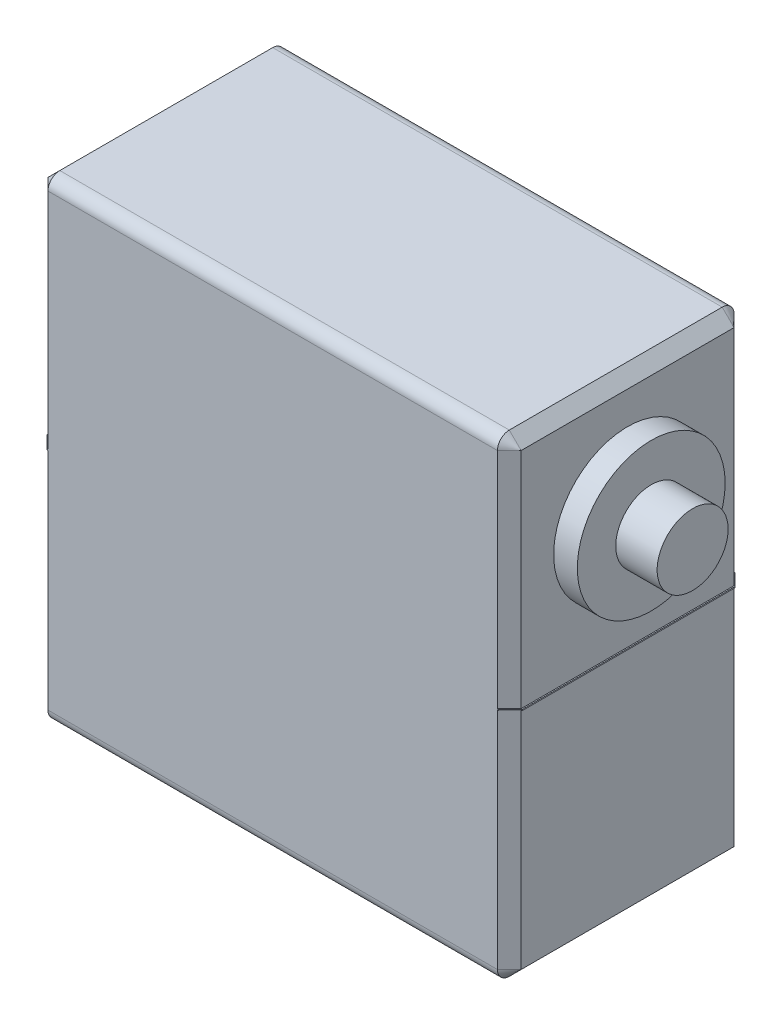
from build123d import *

# Parameters (mm, degrees)
EXTRUDE_439_DEPTH      = 20
EXTRUDE_654_DEPTH      = 2
EXTRUDE_654_DEPTH_BACK = 42
SKETCH2_R              = 6.25
EXTRUDE_763_DEPTH      = 3.5
EXTRUDE_763_DEPTH_BACK = 47.5
SKETCH3_R              = 3
EXTRUDE_995_DEPTH      = 0.1
EXTRUDE_995_DEPTH_BACK = 40.1
SKETCH5_W              = 20
SKETCH5_H              = 0.1
CUT_EXTRUDE_1252_DEPTH = 0.3
FILLET1_R              = 1
CHAMFER1_SIZE          = 1
CHAMFER2_SIZE          = 1


with BuildPart() as part:
    # Sketch1 → Extrude 439 (new body)
    with BuildSketch(Plane.XY):
        Polygon((20, 0), (20, 20), (-20, 20), (-20, -20), (20, -20), align=None)
    extrude(amount=EXTRUDE_439_DEPTH)

    # Sketch2 → Extrude 654 (add, two sides: drawn at the far end of the back side and taken through both)
    with BuildSketch(Plane(origin=(20, 0, 0), x_dir=(0, 0, -1), z_dir=(1, 0, 0)).offset(-EXTRUDE_654_DEPTH_BACK)):
        with Locations((-10, 10)):
            Circle(SKETCH2_R)
    extrude(amount=EXTRUDE_654_DEPTH + EXTRUDE_654_DEPTH_BACK)

    # Sketch3 → Extrude 763 (add, two sides: drawn at the far end of the back side and taken through both)
    with BuildSketch(Plane(origin=(22, 0, 0), x_dir=(0, 0, -1), z_dir=(1, 0, 0)).offset(-EXTRUDE_763_DEPTH_BACK)):
        with Locations((-10, 10)):
            Circle(SKETCH3_R)
    extrude(amount=EXTRUDE_763_DEPTH + EXTRUDE_763_DEPTH_BACK)

    # Sketch5 → Extrude 995 (add, two sides: drawn at the far end of the back side and taken through both)
    with BuildSketch(Plane.ZY.offset(20).offset(-EXTRUDE_995_DEPTH_BACK)):
        with Locations((10, 0.05)):
            Rectangle(SKETCH5_W, SKETCH5_H)
    extrude(amount=EXTRUDE_995_DEPTH + EXTRUDE_995_DEPTH_BACK)

    # Sketch7 → Cut-Extrude 1252 (cut)
    # profile 1 of 8: a face of its own
    with BuildSketch(Plane(origin=(0, 0, 0), x_dir=(-1, 0, 0), z_dir=(0, 0, -1))):
        with BuildLine():
            Line((-13.538461538, 0), (-13.538461538, 4))
            Line((-13.538461538, 4), (-11.802884615, 4))
            add(Edge.make_bspline(
                [(-11.802884615, 4), (-11.762017093, 3.999679786), (-11.682922787, 3.999060049), (-11.568219712, 3.994673018), (-11.461155891, 3.985215729), (-11.361534469, 3.974988989), (-11.269373145, 3.959292309), (-11.184767, 3.941288572), (-11.107585406, 3.919863853), (-11.037483316, 3.894559608), (-10.972443862, 3.865931645), (-10.912157201, 3.830609361), (-10.854117294, 3.791903669), (-10.800478204, 3.746430258), (-10.749825196, 3.696641081), (-10.702205216, 3.641859611), (-10.65832324, 3.581610454), (-10.604200078, 3.495381416), (-10.546136959, 3.380542495), (-10.497761262, 3.23357356), (-10.466569477, 3.07983869), (-10.463231867, 2.974778715), (-10.461538462, 2.921474359)],
                knots=[0, 0, 0, 0, 1.242255013, 2.404239178, 3.487702428, 4.508875116, 5.447164253, 6.327763259, 7.137389581, 7.87956647, 8.591787438, 9.293660819, 10.000726923, 10.709654955, 11.427269343, 12.158170644, 12.913245971, 13.690346794, 15.251572448, 16.809945773, 18.381459854, 20, 20, 20, 20], degree=3))
            add(Edge.make_bspline(
                [(-10.461538462, 2.921474359), (-10.462321192, 2.887257716), (-10.463867138, 2.8196775), (-10.475709244, 2.720316493), (-10.497136577, 2.625381047), (-10.524612908, 2.534039733), (-10.562219623, 2.447586712), (-10.605785371, 2.364256155), (-10.659757138, 2.286337375), (-10.720184499, 2.211755519), (-10.789478478, 2.142107932), (-10.868248653, 2.079907326), (-10.955714192, 2.023957758), (-11.052287024, 1.975802895), (-11.156855497, 1.931787065), (-11.27073166, 1.896343398), (-11.393455916, 1.867400926), (-11.478534075, 1.853385864), (-11.522435897, 1.846153846)],
                knots=[0, 0, 0, 0, 0.982609109, 1.940720374, 2.867584677, 3.775009516, 4.675469332, 5.571146231, 6.471115823, 7.392408543, 8.32534739, 9.286126426, 10.269214477, 11.301811357, 12.381622301, 13.524260118, 14.722474812, 16, 16, 16, 16], degree=3))
            add(Edge.make_bspline(
                [(-11.522435897, 1.846153846), (-11.490232248, 1.829885273), (-11.429076358, 1.798990666), (-11.34440527, 1.750548191), (-11.27263252, 1.701051919), (-11.231050929, 1.66565073), (-11.211538462, 1.649038462)],
                knots=[0, 0, 0, 0, 1.172304973, 2.226249348, 3.167654437, 4, 4, 4, 4], degree=3))
            add(Edge.make_bspline(
                [(-11.211538462, 1.649038462), (-11.173751465, 1.611996162), (-11.09613429, 1.535908648), (-10.98917445, 1.406309322), (-10.885473213, 1.262045386), (-10.822466892, 1.157785351), (-10.790064103, 1.104166667)],
                knots=[0, 0, 0, 0, 0.918110279, 1.885863737, 2.912745394, 4, 4, 4, 4], degree=3))
            Line((-10.790064103, 1.104166667), (-10.133814103, 0))
            Line((-10.133814103, 0), (-10.780448718, 0))
            Line((-10.780448718, 0), (-11.278846154, 0.844551282))
            add(Edge.make_bspline(
                [(-11.278846154, 0.844551282), (-11.296766022, 0.874183379), (-11.331491785, 0.931605517), (-11.381651905, 1.015467786), (-11.430832253, 1.092676366), (-11.476446185, 1.165437921), (-11.52034479, 1.232431501), (-11.562103905, 1.293889829), (-11.600574301, 1.350619156), (-11.64822486, 1.416666857), (-11.703682196, 1.489749251), (-11.768397103, 1.565010316), (-11.830024881, 1.625014961), (-11.905920627, 1.683855898), (-11.999928991, 1.738891704), (-12.079837874, 1.764179145), (-12.118589744, 1.776442308)],
                knots=[0, 0, 0, 0, 1.130940588, 2.191577161, 3.191089816, 4.120344442, 4.99615009, 5.80661983, 6.546979556, 7.234477901, 8.466216387, 9.541989141, 10.473533583, 11.269175393, 12.675684693, 14, 14, 14, 14], degree=3))
            add(Edge.make_bspline(
                [(-12.118589744, 1.776442308), (-12.134848592, 1.779374331), (-12.171968029, 1.786068227), (-12.234996741, 1.790440021), (-12.311363759, 1.795080096), (-12.366708238, 1.794944899), (-12.396634615, 1.794871795)],
                knots=[0, 0, 0, 0, 0.709978628, 1.620902492, 2.713552433, 4, 4, 4, 4], degree=3))
            Line((-12.396634615, 1.794871795), (-12.974358974, 1.794871795))
            Line((-12.974358974, 1.794871795), (-12.974358974, 0))
            Line((-12.974358974, 0), (-13.538461538, 0))
        make_face()
        with BuildLine():
            Line((-12.974358974, 2.256410256), (-11.903044872, 2.256410256))
            add(Edge.make_bspline(
                [(-11.903044872, 2.256410256), (-11.849325125, 2.257250753), (-11.748901096, 2.258821982), (-11.608473979, 2.272238628), (-11.48879883, 2.293558247), (-11.387509843, 2.324655409), (-11.302411105, 2.367828597), (-11.228399117, 2.420443194), (-11.166894222, 2.486348453), (-11.115728503, 2.560708507), (-11.075956341, 2.642538035), (-11.047266599, 2.728487956), (-11.028488665, 2.817835918), (-11.026598646, 2.878644903), (-11.025641026, 2.909455128)],
                knots=[0, 0, 0, 0, 1.546323217, 2.890706218, 4.056530419, 5.041445823, 5.928701482, 6.793137403, 7.641659452, 8.509781392, 9.383301667, 10.251423607, 11.114044887, 12, 12, 12, 12], degree=3))
            add(Edge.make_bspline(
                [(-11.025641026, 2.909455128), (-11.026385535, 2.931907711), (-11.027843811, 2.975885724), (-11.035488575, 3.040433237), (-11.05035181, 3.101768295), (-11.069978676, 3.16021512), (-11.096204151, 3.215345632), (-11.127358946, 3.267587031), (-11.164536234, 3.316649775), (-11.207120679, 3.362683315), (-11.25601536, 3.404569339), (-11.31186458, 3.440707892), (-11.374227861, 3.471417866), (-11.443177689, 3.495791354), (-11.518496859, 3.515286177), (-11.600614148, 3.528255454), (-11.689154015, 3.53763998), (-11.750507008, 3.538182569), (-11.782051282, 3.538461538)],
                knots=[0, 0, 0, 0, 0.965208469, 1.890559848, 2.786986821, 3.67262109, 4.535197034, 5.405224191, 6.282113641, 7.175449223, 8.095446547, 9.040936516, 10.026471658, 11.075712529, 12.17809725, 13.364958037, 14.645208957, 16, 16, 16, 16], degree=3))
            Line((-11.782051282, 3.538461538), (-12.974358974, 3.538461538))
            Line((-12.974358974, 3.538461538), (-12.974358974, 2.256410256))
        make_face(mode=Mode.SUBTRACT)
    # profile 2 of 8: a face of its own
    with BuildSketch(Plane(origin=(0, 0, 0), x_dir=(-1, 0, 0), z_dir=(0, 0, -1))):
        with BuildLine():
            Line((-9.538461538, 0), (-9.538461538, 4))
            Line((-9.538461538, 4), (-8.170673077, 4))
            add(Edge.make_bspline(
                [(-8.170673077, 4), (-8.133279564, 3.999831071), (-8.060621107, 3.999502828), (-7.955077313, 3.997410796), (-7.856249726, 3.992364836), (-7.764593731, 3.986218189), (-7.679647065, 3.978034457), (-7.601518252, 3.968883007), (-7.530146331, 3.956946137), (-7.485274023, 3.947024371), (-7.463942308, 3.942307692)],
                knots=[0, 0, 0, 0, 1.263127796, 2.454354013, 3.565393221, 4.605443485, 5.557051711, 6.447822442, 7.26211484, 8, 8, 8, 8], degree=3))
            add(Edge.make_bspline(
                [(-7.463942308, 3.942307692), (-7.408774816, 3.927833856), (-7.300392888, 3.89939859), (-7.147400396, 3.835437136), (-7.00694663, 3.755209162), (-6.923648705, 3.689124368), (-6.882211538, 3.65625)],
                knots=[0, 0, 0, 0, 1.04477941, 2.052571232, 3.03123721, 4, 4, 4, 4], degree=3))
            add(Edge.make_bspline(
                [(-6.882211538, 3.65625), (-6.856483439, 3.633656553), (-6.804910777, 3.588367387), (-6.734076034, 3.513750177), (-6.668363813, 3.434593444), (-6.605811391, 3.352259936), (-6.550419564, 3.263747991), (-6.498497499, 3.171605218), (-6.453208885, 3.073981268), (-6.411521398, 2.972471596), (-6.374380692, 2.86668055), (-6.343863464, 2.756676447), (-6.315827845, 2.643607994), (-6.294975855, 2.526239225), (-6.276773146, 2.405565674), (-6.265217575, 2.280896653), (-6.257719932, 2.152604322), (-6.256851066, 2.065716288), (-6.256410256, 2.021634615)],
                knots=[0, 0, 0, 0, 0.908997367, 1.822109427, 2.728529095, 3.640759027, 4.565643067, 5.499218265, 6.448003669, 7.421473682, 8.413047621, 9.423472075, 10.452328391, 11.505545429, 12.587978234, 13.692612971, 14.829372988, 16, 16, 16, 16], degree=3))
            add(Edge.make_bspline(
                [(-6.256410256, 2.021634615), (-6.257484745, 1.9478648), (-6.259575676, 1.804310477), (-6.280254179, 1.595513385), (-6.312252408, 1.399250956), (-6.358821301, 1.216701684), (-6.416175754, 1.048878051), (-6.478744484, 0.894409403), (-6.550765539, 0.755957376), (-6.629771021, 0.632351609), (-6.714423301, 0.522810031), (-6.803106613, 0.425688611), (-6.896083844, 0.340944371), (-6.99288269, 0.266353285), (-7.09853045, 0.204589814), (-7.211918787, 0.149131421), (-7.336726383, 0.104570622), (-7.470602875, 0.065592309), (-7.615120704, 0.036390695), (-7.769497299, 0.014932409), (-7.934339371, 0.001956315), (-8.047518774, 0.00066474), (-8.105769231, 0)],
                knots=[0, 0, 0, 0, 1.410753827, 2.745293735, 4.009435601, 5.211453015, 6.344066657, 7.400119332, 8.396481539, 9.324811333, 10.202671465, 11.041621015, 11.837259285, 12.606727868, 13.374311266, 14.17412185, 15.017911533, 15.905707008, 16.839601966, 17.835295848, 18.885883805, 20, 20, 20, 20], degree=3))
            Line((-8.105769231, 0), (-9.538461538, 0))
        make_face()
        with BuildLine():
            Line((-8.974358974, 0.461538462), (-8.149839744, 0.461538462))
            add(Edge.make_bspline(
                [(-8.149839744, 0.461538462), (-8.089717852, 0.462438462), (-7.975980629, 0.464141062), (-7.815515368, 0.477216982), (-7.675466175, 0.49977119), (-7.554280056, 0.531859739), (-7.449132182, 0.573355161), (-7.356548964, 0.622412661), (-7.274195036, 0.678081898), (-7.227805058, 0.722619615), (-7.205128205, 0.744391026)],
                knots=[0, 0, 0, 0, 1.423649224, 2.693227144, 3.808972214, 4.778671344, 5.656058397, 6.479437267, 7.256702014, 8, 8, 8, 8], degree=3))
            add(Edge.make_bspline(
                [(-7.205128205, 0.744391026), (-7.175618806, 0.778132795), (-7.11499635, 0.847449996), (-7.039505669, 0.968543457), (-6.973674121, 1.104796788), (-6.918642686, 1.257660488), (-6.873518335, 1.426617515), (-6.843422113, 1.61318124), (-6.823744951, 1.816083115), (-6.821617027, 1.957214106), (-6.820512821, 2.030448718)],
                knots=[0, 0, 0, 0, 0.782184731, 1.606876467, 2.483531085, 3.422528604, 4.441347086, 5.534669947, 6.720709839, 8, 8, 8, 8], degree=3))
            add(Edge.make_bspline(
                [(-6.820512821, 2.030448718), (-6.82119698, 2.081472108), (-6.822526958, 2.180659513), (-6.830818233, 2.325158927), (-6.847186429, 2.460395923), (-6.868119821, 2.586604409), (-6.896701084, 2.703383207), (-6.929384252, 2.811851189), (-6.970500798, 2.910590411), (-7.017419817, 3.000363142), (-7.068890526, 3.081765568), (-7.122524853, 3.156546158), (-7.17859727, 3.224459736), (-7.238295911, 3.28454001), (-7.299826162, 3.338563689), (-7.364335113, 3.385424726), (-7.431642246, 3.425108722), (-7.478938538, 3.44570899), (-7.502403846, 3.455929487)],
                knots=[0, 0, 0, 0, 1.460126857, 2.838427476, 4.139102445, 5.35666337, 6.496721546, 7.577303074, 8.594995104, 9.55219858, 10.472533725, 11.348579167, 12.184287935, 12.989560785, 13.769667798, 14.524891986, 15.268148459, 16, 16, 16, 16], degree=3))
            add(Edge.make_bspline(
                [(-7.502403846, 3.455929487), (-7.520738706, 3.462639253), (-7.559589071, 3.476856806), (-7.622996635, 3.492948939), (-7.693760118, 3.507758158), (-7.77257701, 3.518152299), (-7.859048697, 3.52825427), (-7.953712685, 3.534393028), (-8.056072502, 3.537174952), (-8.126868228, 3.538023128), (-8.163461538, 3.538461538)],
                knots=[0, 0, 0, 0, 0.699400087, 1.48198292, 2.341906832, 3.289648813, 4.329964754, 5.462247508, 6.688271602, 8, 8, 8, 8], degree=3))
            Line((-8.163461538, 3.538461538), (-8.974358974, 3.538461538))
            Line((-8.974358974, 3.538461538), (-8.974358974, 0.461538462))
        make_face(mode=Mode.SUBTRACT)
    # profile 3 of 8: a face of its own
    with BuildSketch(Plane(origin=(0, 0, 0), x_dir=(-1, 0, 0), z_dir=(0, 0, -1))):
        with BuildLine():
            Line((-5.743589744, 1.384615385), (-5.179487179, 1.384615385))
            add(Edge.make_bspline(
                [(-5.179487179, 1.384615385), (-5.173282379, 1.333966731), (-5.161362622, 1.236667941), (-5.128033791, 1.098761553), (-5.085137436, 0.974769557), (-5.03168976, 0.863046361), (-4.961381379, 0.764931518), (-4.876671874, 0.676433428), (-4.77379679, 0.599799441), (-4.657674271, 0.531600214), (-4.528346192, 0.478053034), (-4.390276934, 0.438357628), (-4.244124966, 0.414837784), (-4.144049093, 0.411804999), (-4.092948718, 0.41025641)],
                knots=[0, 0, 0, 0, 1.125557648, 2.162256852, 3.1243583, 4.018160113, 4.88511607, 5.777380551, 6.711250965, 7.707237736, 8.743031335, 9.791730543, 10.872421559, 12, 12, 12, 12], degree=3))
            add(Edge.make_bspline(
                [(-4.092948718, 0.41025641), (-4.047729287, 0.411093374), (-3.959560153, 0.412725291), (-3.832013645, 0.432328654), (-3.711992011, 0.460135498), (-3.601728978, 0.502197704), (-3.501631295, 0.55327441), (-3.414707671, 0.615052884), (-3.340496905, 0.684722032), (-3.282384496, 0.764116901), (-3.236732548, 0.847309447), (-3.203242125, 0.932822804), (-3.183292566, 1.020182334), (-3.180750474, 1.07896233), (-3.179487179, 1.108173077)],
                knots=[0, 0, 0, 0, 1.267006637, 2.470417599, 3.611360613, 4.716023143, 5.771382139, 6.754486395, 7.697536124, 8.612899418, 9.501261124, 10.352596716, 11.181322154, 12, 12, 12, 12], degree=3))
            add(Edge.make_bspline(
                [(-3.179487179, 1.108173077), (-3.180837664, 1.137087936), (-3.183477185, 1.193601986), (-3.200678211, 1.275879384), (-3.233371192, 1.351187101), (-3.275794091, 1.422598849), (-3.334811587, 1.48788942), (-3.409373533, 1.548048858), (-3.501122717, 1.602589987), (-3.569599678, 1.632459888), (-3.605769231, 1.648237179)],
                knots=[0, 0, 0, 0, 0.942140154, 1.841411588, 2.718743672, 3.605002079, 4.535543111, 5.568170452, 6.715506882, 8, 8, 8, 8], degree=3))
            add(Edge.make_bspline(
                [(-3.605769231, 1.648237179), (-3.619861423, 1.65402015), (-3.651698246, 1.667084932), (-3.706265067, 1.684380453), (-3.77101551, 1.706745327), (-3.847505153, 1.729777507), (-3.935324513, 1.754142332), (-4.03432738, 1.78171962), (-4.144458432, 1.811046557), (-4.262594163, 1.842261886), (-4.381875252, 1.87400309), (-4.495834397, 1.905774018), (-4.600682228, 1.93802558), (-4.69727759, 1.969079381), (-4.785122491, 2.0002613), (-4.864466254, 2.030717644), (-4.935407802, 2.059830492), (-4.978736198, 2.081236723), (-4.999198718, 2.091346154)],
                knots=[0, 0, 0, 0, 0.499201778, 1.127787504, 1.87543728, 2.745208432, 3.745951656, 4.863402235, 6.114490242, 7.482339553, 8.869366102, 10.161191451, 11.360587006, 12.46547846, 13.487450326, 14.41601931, 15.251940103, 16, 16, 16, 16], degree=3))
            add(Edge.make_bspline(
                [(-4.999198718, 2.091346154), (-5.046277268, 2.116779343), (-5.137151122, 2.165872016), (-5.259457265, 2.253649854), (-5.362512607, 2.351055612), (-5.445882377, 2.457948047), (-5.511216003, 2.572519352), (-5.555296315, 2.694964298), (-5.58548769, 2.823060282), (-5.588309153, 2.911146354), (-5.58974359, 2.955929487)],
                knots=[0, 0, 0, 0, 1.158441928, 2.236094408, 3.251151369, 4.220012324, 5.163146324, 6.095083285, 7.031536583, 8, 8, 8, 8], degree=3))
            add(Edge.make_bspline(
                [(-5.58974359, 2.955929487), (-5.587839806, 3.005519242), (-5.584053195, 3.104152905), (-5.550463875, 3.248891657), (-5.496888268, 3.388168835), (-5.435902957, 3.49874303), (-5.376428802, 3.582358741), (-5.327124275, 3.642577248), (-5.271819605, 3.698241162), (-5.212217984, 3.750127513), (-5.147253971, 3.79746106), (-5.078539332, 3.842187152), (-5.003586978, 3.880630301), (-4.898267776, 3.929559753), (-4.757376059, 3.978420387), (-4.58001101, 4.020996231), (-4.39334012, 4.046068261), (-4.266100857, 4.049519539), (-4.201121795, 4.051282051)],
                knots=[0, 0, 0, 0, 1.199927478, 2.386647047, 3.578628709, 4.806592355, 5.433127754, 6.062729195, 6.689531802, 7.331674828, 7.974827539, 8.635320743, 9.315455226, 10.01318112, 11.447700238, 12.918145351, 14.426146008, 16, 16, 16, 16], degree=3))
            add(Edge.make_bspline(
                [(-4.201121795, 4.051282051), (-4.129997896, 4.049652356), (-3.99150596, 4.046479025), (-3.790273262, 4.020077487), (-3.602578245, 3.9747391), (-3.455381372, 3.923987324), (-3.346560446, 3.872608037), (-3.26925103, 3.832517301), (-3.197492604, 3.786165107), (-3.130639198, 3.736004782), (-3.068069834, 3.682059233), (-3.011392685, 3.623045275), (-2.958146672, 3.560976356), (-2.895575187, 3.471864836), (-2.828109861, 3.353926244), (-2.769776903, 3.201132114), (-2.72970148, 3.039870454), (-2.721905888, 2.92838614), (-2.717948718, 2.871794872)],
                knots=[0, 0, 0, 0, 1.607600973, 3.130308851, 4.577334065, 5.967726088, 6.640410691, 7.296826776, 7.935019992, 8.569057421, 9.185393759, 9.8003086, 10.417295362, 11.032210203, 12.259799365, 13.477607022, 14.719591916, 16, 16, 16, 16], degree=3))
            Line((-2.717948718, 2.871794872), (-3.282051282, 2.871794872))
            add(Edge.make_bspline(
                [(-3.282051282, 2.871794872), (-3.285635507, 2.900437367), (-3.292648772, 2.956482242), (-3.310047752, 3.037615629), (-3.334437621, 3.112968669), (-3.363005632, 3.183244079), (-3.397636042, 3.247710916), (-3.438005079, 3.306988205), (-3.484604354, 3.360377558), (-3.536234816, 3.409289725), (-3.594467573, 3.451878569), (-3.659003405, 3.488846994), (-3.729951251, 3.520076847), (-3.807248607, 3.545655115), (-3.890910775, 3.565487504), (-3.981128047, 3.580076588), (-4.077865551, 3.587548311), (-4.144487164, 3.588998941), (-4.178685897, 3.58974359)],
                knots=[0, 0, 0, 0, 1.074487479, 2.102453544, 3.083708351, 4.020042547, 4.923259678, 5.803182661, 6.684453325, 7.556870173, 8.445961597, 9.363679789, 10.320905216, 11.327237703, 12.390948353, 13.519046902, 14.726457512, 16, 16, 16, 16], degree=3))
            add(Edge.make_bspline(
                [(-4.178685897, 3.58974359), (-4.214233886, 3.589475646), (-4.283046049, 3.588956972), (-4.382521834, 3.579502201), (-4.474723029, 3.566529921), (-4.559491268, 3.547394703), (-4.636548861, 3.522346639), (-4.707039454, 3.493421873), (-4.768990292, 3.45676664), (-4.823845557, 3.415937477), (-4.87116517, 3.370762265), (-4.911947668, 3.323158513), (-4.948016637, 3.274524854), (-4.976043021, 3.222202941), (-4.998860711, 3.168174284), (-5.013580627, 3.111423321), (-5.024002672, 3.052999798), (-5.025087361, 3.013136256), (-5.025641026, 2.992788462)],
                knots=[0, 0, 0, 0, 1.464176581, 2.834285765, 4.113735764, 5.29917439, 6.409476712, 7.449999357, 8.431575861, 9.367089851, 10.262376129, 11.120706676, 11.948504824, 12.751342953, 13.560717798, 14.359016663, 15.162382702, 16, 16, 16, 16], degree=3))
            add(Edge.make_bspline(
                [(-5.025641026, 2.992788462), (-5.024183252, 2.95837422), (-5.021353847, 2.89157935), (-4.99246149, 2.796683974), (-4.948024842, 2.71018069), (-4.904247664, 2.663114695), (-4.882211538, 2.639423077)],
                knots=[0, 0, 0, 0, 1.050964922, 2.039826012, 3.013306874, 4, 4, 4, 4], degree=3))
            add(Edge.make_bspline(
                [(-4.882211538, 2.639423077), (-4.8683202, 2.62758314), (-4.837600362, 2.60139985), (-4.780441367, 2.566749331), (-4.709572692, 2.531739398), (-4.624520801, 2.496936816), (-4.525432032, 2.461919084), (-4.412466214, 2.425864023), (-4.285193076, 2.390054606), (-4.147491262, 2.355546308), (-4.008380321, 2.320899284), (-3.87617816, 2.28638431), (-3.754794197, 2.253673613), (-3.644421019, 2.221769686), (-3.544944384, 2.190762742), (-3.456710012, 2.160003145), (-3.379004053, 2.131712119), (-3.331399972, 2.111807072), (-3.309294872, 2.102564103)],
                knots=[0, 0, 0, 0, 0.523891492, 1.158553688, 1.913783773, 2.794766643, 3.797521443, 4.933638669, 6.202080764, 7.596537849, 9.013317056, 10.322179469, 11.523240428, 12.626146501, 13.623953177, 14.517289671, 15.311498917, 16, 16, 16, 16], degree=3))
            add(Edge.make_bspline(
                [(-3.309294872, 2.102564103), (-3.280535014, 2.089303961), (-3.224084233, 2.063276526), (-3.144114142, 2.018838596), (-3.069493372, 1.972692198), (-3.000824808, 1.923594914), (-2.938330488, 1.871443471), (-2.881311653, 1.816835409), (-2.82942393, 1.760077635), (-2.784760983, 1.699353568), (-2.744658239, 1.637117949), (-2.709565668, 1.572500956), (-2.681309803, 1.505122589), (-2.656527647, 1.43579503), (-2.638702169, 1.363747156), (-2.624723399, 1.289706699), (-2.616569816, 1.213325647), (-2.615783097, 1.161610836), (-2.615384615, 1.135416667)],
                knots=[0, 0, 0, 0, 1.198900896, 2.353241543, 3.461831299, 4.520043694, 5.547003373, 6.541368882, 7.508191797, 8.454912692, 9.392021408, 10.310662301, 11.235020644, 12.156274873, 13.095836685, 14.042125239, 15.00831306, 16, 16, 16, 16], degree=3))
            add(Edge.make_bspline(
                [(-2.615384615, 1.135416667), (-2.61747214, 1.083140224), (-2.621616569, 0.979354111), (-2.657301601, 0.826368579), (-2.713360899, 0.678126454), (-2.779104313, 0.560488161), (-2.841251709, 0.470629601), (-2.893458454, 0.406043375), (-2.951352732, 0.346323567), (-3.013509246, 0.289599269), (-3.080410582, 0.237027842), (-3.152620759, 0.188591384), (-3.229377634, 0.143785676), (-3.338984521, 0.089187298), (-3.484560676, 0.032072209), (-3.669995473, -0.015491302), (-3.865421288, -0.046346928), (-3.999612717, -0.049614276), (-4.068108974, -0.051282051)],
                knots=[0, 0, 0, 0, 1.197055466, 2.376552968, 3.581957237, 4.820753935, 5.454298064, 6.085440993, 6.72202542, 7.359198513, 8.013298489, 8.67051481, 9.351020706, 10.049282741, 11.476266879, 12.925760103, 14.430794493, 16, 16, 16, 16], degree=3))
            add(Edge.make_bspline(
                [(-4.068108974, -0.051282051), (-4.111660317, -0.050922646), (-4.196971175, -0.050218622), (-4.322325953, -0.041692667), (-4.442455727, -0.029359456), (-4.557242608, -0.010989), (-4.666326635, 0.013112041), (-4.77009937, 0.042052733), (-4.868806784, 0.075383907), (-4.96210399, 0.11458079), (-5.049747442, 0.160123285), (-5.13331306, 0.209252115), (-5.211434907, 0.264941946), (-5.28427744, 0.326317698), (-5.353686334, 0.391606279), (-5.416784796, 0.463474022), (-5.475718013, 0.539819255), (-5.529139378, 0.621340718), (-5.576863234, 0.706971841), (-5.619780578, 0.795274543), (-5.655939041, 0.886889388), (-5.685079321, 0.981353359), (-5.709762614, 1.078034301), (-5.726879907, 1.177738848), (-5.739465117, 1.280153964), (-5.742206747, 1.349589238), (-5.743589744, 1.384615385)],
                knots=[0, 0, 0, 0, 1.259822038, 2.467811403, 3.633536148, 4.752793854, 5.829021491, 6.863980041, 7.868367876, 8.841470325, 9.788447787, 10.724101269, 11.643985084, 12.560193707, 13.478453146, 14.398077254, 15.323914234, 16.266973849, 17.21495974, 18.158525798, 19.105629373, 20.061269543, 21.017128399, 21.990322895, 22.986232211, 24, 24, 24, 24], degree=3))
        make_face()
    # profile 4 of 8: a face of its own
    with BuildSketch(Plane(origin=(0, 0, 0), x_dir=(-1, 0, 0), z_dir=(0, 0, -1))):
        with BuildLine():
            Line((-2.051282051, 1.076923077), (-1.538461538, 1.128205128))
            add(Edge.make_bspline(
                [(-1.538461538, 1.128205128), (-1.531625027, 1.097391835), (-1.518396884, 1.037770397), (-1.492944321, 0.952356494), (-1.466060826, 0.873073293), (-1.432733514, 0.801694168), (-1.400213301, 0.735300008), (-1.361997126, 0.676634159), (-1.321162401, 0.624165949), (-1.276954229, 0.578090206), (-1.22886319, 0.538413364), (-1.177530445, 0.503693987), (-1.121870352, 0.474698633), (-1.06230906, 0.451741379), (-0.999348217, 0.433157287), (-0.932645663, 0.419511325), (-0.861848685, 0.411382255), (-0.813323103, 0.410637816), (-0.788461538, 0.41025641)],
                knots=[0, 0, 0, 0, 1.321063709, 2.556160278, 3.730472002, 4.821700466, 5.852032229, 6.822994757, 7.746964065, 8.632786469, 9.490489437, 10.352773447, 11.223141997, 12.11199479, 13.021433979, 13.96892724, 14.959401504, 16, 16, 16, 16], degree=3))
            add(Edge.make_bspline(
                [(-0.788461538, 0.41025641), (-0.759299805, 0.410672186), (-0.702346891, 0.411484196), (-0.619357102, 0.423667457), (-0.540377682, 0.440396235), (-0.46653546, 0.466627915), (-0.396802222, 0.498687879), (-0.331575242, 0.538307192), (-0.270408047, 0.584830181), (-0.214507113, 0.638573298), (-0.164515047, 0.69769244), (-0.119990088, 0.760137342), (-0.083173929, 0.826440828), (-0.052143451, 0.895668994), (-0.0292389, 0.968940534), (-0.01247092, 1.045341789), (-0.001512959, 1.125218277), (-0.000511241, 1.179717572), (0, 1.207532051)],
                knots=[0, 0, 0, 0, 1.111377895, 2.170522867, 3.193923215, 4.186422864, 5.152846954, 6.117443035, 7.091571248, 8.078879332, 9.069127402, 10.041602243, 10.999610288, 11.957618333, 12.930786866, 13.922135183, 14.939532534, 16, 16, 16, 16], degree=3))
            add(Edge.make_bspline(
                [(0, 1.207532051), (-0.000600858, 1.234001776), (-0.001776389, 1.285787683), (-0.011440206, 1.361798284), (-0.028303354, 1.433952846), (-0.051679707, 1.502668953), (-0.081549889, 1.567845727), (-0.117452968, 1.630022116), (-0.161365376, 1.687835523), (-0.210792664, 1.741906916), (-0.264703415, 1.791722182), (-0.323700452, 1.834096478), (-0.385787507, 1.870666876), (-0.451704517, 1.900196042), (-0.521177791, 1.92363351), (-0.594141099, 1.940478478), (-0.670945235, 1.950146489), (-0.723263259, 1.951322226), (-0.75, 1.951923077)],
                knots=[0, 0, 0, 0, 1.072815875, 2.098878726, 3.09954706, 4.07199174, 5.036203424, 6.001873089, 6.97636515, 7.972747947, 8.969130744, 9.945905975, 10.911575641, 11.885646534, 12.868345115, 13.879560892, 14.916365174, 16, 16, 16, 16], degree=3))
            add(Edge.make_bspline(
                [(-0.75, 1.951923077), (-0.773540077, 1.951299426), (-0.823497608, 1.949975894), (-0.90234731, 1.938289605), (-0.989686711, 1.921926059), (-1.05004073, 1.905867666), (-1.081730769, 1.897435897)],
                knots=[0, 0, 0, 0, 0.837610211, 1.777604146, 2.833088267, 4, 4, 4, 4], degree=3))
            Line((-1.081730769, 1.897435897), (-1.028846154, 2.358974359))
            add(Edge.make_bspline(
                [(-1.028846154, 2.358974359), (-1.014970468, 2.357458126), (-0.990456906, 2.354779463), (-0.965819726, 2.353793327), (-0.955128205, 2.353365385)],
                knots=[0, 0, 0, 0, 1.132082448, 2, 2, 2, 2], degree=3))
            add(Edge.make_bspline(
                [(-0.955128205, 2.353365385), (-0.9079657, 2.355166031), (-0.81544769, 2.358698333), (-0.680574367, 2.388048804), (-0.552754013, 2.434260173), (-0.454004533, 2.48939704), (-0.380775255, 2.541256259), (-0.334598345, 2.588014701), (-0.292967478, 2.637634854), (-0.261907449, 2.694550966), (-0.2350735, 2.75502571), (-0.218456638, 2.821441347), (-0.206338263, 2.892183484), (-0.2055388, 2.941181411), (-0.205128205, 2.966346154)],
                knots=[0, 0, 0, 0, 1.557468908, 3.055264441, 4.54122591, 6.035034992, 6.780215604, 7.498173296, 8.201377046, 8.913174237, 9.633083494, 10.382644491, 11.169345745, 12, 12, 12, 12], degree=3))
            add(Edge.make_bspline(
                [(-0.205128205, 2.966346154), (-0.205507154, 2.986672565), (-0.206248271, 3.026425292), (-0.214504646, 3.084706987), (-0.228159676, 3.139930688), (-0.246615808, 3.192686032), (-0.270804401, 3.242696536), (-0.300800156, 3.289900978), (-0.335071324, 3.335256938), (-0.375527224, 3.376420715), (-0.418851984, 3.41506739), (-0.466625479, 3.447615815), (-0.516574047, 3.476530307), (-0.570459262, 3.498379638), (-0.626950824, 3.516343351), (-0.68653163, 3.528931594), (-0.749223426, 3.537385443), (-0.792171814, 3.538097791), (-0.814102564, 3.538461538)],
                knots=[0, 0, 0, 0, 1.041493611, 2.036867705, 3.009952345, 3.954088258, 4.897230656, 5.850851638, 6.817653571, 7.805463921, 8.805067469, 9.788883576, 10.763797054, 11.758134544, 12.762883247, 13.799594994, 14.876406454, 16, 16, 16, 16], degree=3))
            add(Edge.make_bspline(
                [(-0.814102564, 3.538461538), (-0.857020487, 3.536788098), (-0.939901358, 3.533556436), (-1.058563208, 3.503656861), (-1.166092268, 3.455275457), (-1.2457016, 3.398537578), (-1.302231226, 3.344292956), (-1.340843955, 3.298314383), (-1.375380852, 3.24754063), (-1.405939803, 3.191989795), (-1.432107947, 3.131438473), (-1.455697802, 3.066636804), (-1.473958538, 2.996547313), (-1.482697798, 2.947982206), (-1.487179487, 2.923076923)],
                knots=[0, 0, 0, 0, 1.533565899, 2.961543033, 4.347411787, 5.731829577, 6.434842101, 7.147085226, 7.87612511, 8.629021686, 9.412189982, 10.234506416, 11.094615066, 12, 12, 12, 12], degree=3))
            Line((-1.487179487, 2.923076923), (-2, 2.974358974))
            add(Edge.make_bspline(
                [(-2, 2.974358974), (-1.991977956, 3.014010814), (-1.976242086, 3.09179102), (-1.944182995, 3.204126832), (-1.905087329, 3.309578169), (-1.858146412, 3.40766156), (-1.805577884, 3.499550829), (-1.744936272, 3.584156029), (-1.67764332, 3.661980148), (-1.6035795, 3.732785811), (-1.523750269, 3.796023188), (-1.438557707, 3.850573723), (-1.348700957, 3.896813162), (-1.25409589, 3.934090331), (-1.154817411, 3.964402318), (-1.050583077, 3.984484085), (-0.941864689, 3.998068387), (-0.867831898, 3.999348208), (-0.830128205, 4)],
                knots=[0, 0, 0, 0, 1.136581168, 2.229493434, 3.279335563, 4.293305329, 5.282068175, 6.250623624, 7.213783178, 8.169396253, 9.125981663, 10.071280146, 11.007896369, 11.961295906, 12.925420184, 13.920544621, 14.940967302, 16, 16, 16, 16], degree=3))
            add(Edge.make_bspline(
                [(-0.830128205, 4), (-0.777937319, 3.998307578), (-0.675313162, 3.994979729), (-0.524582192, 3.968549551), (-0.380408813, 3.925177102), (-0.243953177, 3.865055153), (-0.117562933, 3.791587717), (-0.005717985, 3.70354147), (0.090086452, 3.602439593), (0.167989588, 3.48938742), (0.229677944, 3.369020641), (0.275325473, 3.244074702), (0.302600557, 3.114693439), (0.305991606, 3.027102356), (0.307692308, 2.983173077)],
                knots=[0, 0, 0, 0, 1.104647871, 2.172094857, 3.229560912, 4.285649672, 5.322588163, 6.317201348, 7.289435229, 8.260615662, 9.214246199, 10.146367077, 11.070353327, 12, 12, 12, 12], degree=3))
            add(Edge.make_bspline(
                [(0.307692308, 2.983173077), (0.305968136, 2.941646864), (0.302563841, 2.859655346), (0.276354793, 2.739769222), (0.232066715, 2.6261906), (0.172205863, 2.518520985), (0.094581025, 2.419088819), (-0.000594587, 2.330485696), (-0.111798412, 2.251863817), (-0.195136274, 2.210941999), (-0.237980769, 2.189903846)],
                knots=[0, 0, 0, 0, 0.975609618, 1.926294443, 2.868398979, 3.832526731, 4.812148358, 5.820404151, 6.879456693, 8, 8, 8, 8], degree=3))
            add(Edge.make_bspline(
                [(-0.237980769, 2.189903846), (-0.209256394, 2.18265151), (-0.152993727, 2.168446299), (-0.072187778, 2.139013504), (0.003778886, 2.104555106), (0.075917332, 2.065526915), (0.142133246, 2.019369752), (0.204709031, 1.968902128), (0.261279178, 1.911693486), (0.313482626, 1.849782842), (0.360981354, 1.783818104), (0.400951999, 1.712516108), (0.435445504, 1.637751258), (0.464858286, 1.558981287), (0.485994244, 1.47559882), (0.501107122, 1.388249821), (0.511080389, 1.29723777), (0.512234787, 1.235069182), (0.512820513, 1.203525641)],
                knots=[0, 0, 0, 0, 1.053251915, 2.063013066, 3.05373318, 4.018979697, 4.975584284, 5.920798056, 6.874756953, 7.832116109, 8.799604348, 9.761196922, 10.734637845, 11.72654167, 12.747371341, 13.789206138, 14.878271633, 16, 16, 16, 16], degree=3))
            add(Edge.make_bspline(
                [(0.512820513, 1.203525641), (0.511844481, 1.160461119), (0.509926266, 1.075825515), (0.491741522, 0.951493887), (0.46202357, 0.832367471), (0.42089791, 0.718041739), (0.368785191, 0.608050105), (0.303392324, 0.503944739), (0.226657405, 0.404879405), (0.139780078, 0.311802617), (0.04459765, 0.226262184), (-0.058766824, 0.152192348), (-0.168268288, 0.089291077), (-0.284084937, 0.0379954), (-0.405909743, -0.002305264), (-0.533863897, -0.031194068), (-0.66834335, -0.048172315), (-0.7601007, -0.050231831), (-0.806891026, -0.051282051)],
                knots=[0, 0, 0, 0, 1.016055063, 1.996874249, 2.958724482, 3.910019225, 4.860394196, 5.826121543, 6.806008102, 7.814207964, 8.82789325, 9.821757317, 10.810247154, 11.803791187, 12.806673825, 13.834534493, 14.895752369, 16, 16, 16, 16], degree=3))
            add(Edge.make_bspline(
                [(-0.806891026, -0.051282051), (-0.84888146, -0.050491122), (-0.931546358, -0.048934051), (-1.052550698, -0.032712025), (-1.168479147, -0.009691108), (-1.278415008, 0.025798403), (-1.38363528, 0.069077288), (-1.482357917, 0.124446092), (-1.576358024, 0.188007334), (-1.663870871, 0.261576976), (-1.744410448, 0.342778629), (-1.816261385, 0.430411251), (-1.877960274, 0.524280274), (-1.932359938, 0.622981235), (-1.976328936, 0.728374699), (-2.010565763, 0.839555793), (-2.036671802, 0.956111893), (-2.046358979, 1.036214519), (-2.051282051, 1.076923077)],
                knots=[0, 0, 0, 0, 1.08471039, 2.135426191, 3.150939737, 4.135689946, 5.116584603, 6.086901885, 7.055842759, 8.045878862, 9.036901429, 10.008421467, 10.96965771, 11.936653536, 12.917548193, 13.915472582, 14.940632654, 16, 16, 16, 16], degree=3))
        make_face()
    # profile 5 of 8: a face of its own
    with BuildSketch(Plane(origin=(0, 0, 0), x_dir=(-1, 0, 0), z_dir=(0, 0, -1))):
        with BuildLine():
            Line((2.820512821, 0), (2.307692308, 0))
            Line((2.307692308, 0), (2.307692308, 3.116987179))
            add(Edge.make_bspline(
                [(2.307692308, 3.116987179), (2.278164057, 3.088510815), (2.216792825, 3.029325812), (2.113051239, 2.945564253), (1.997262372, 2.860668363), (1.870929814, 2.779031473), (1.742155144, 2.702179146), (1.617711004, 2.633062292), (1.499675042, 2.574572665), (1.421924117, 2.542590305), (1.384615385, 2.52724359)],
                knots=[0, 0, 0, 0, 0.893362401, 1.856755847, 2.901947673, 4.020460078, 5.132200827, 6.168787962, 7.121294059, 8, 8, 8, 8], degree=3))
            Line((1.384615385, 2.52724359), (1.384615385, 3))
            add(Edge.make_bspline(
                [(1.384615385, 3), (1.448696988, 3.033002154), (1.574998034, 3.098047446), (1.753434101, 3.210389606), (1.920023364, 3.332173132), (2.072008111, 3.463371062), (2.208252752, 3.597478898), (2.32306809, 3.732798971), (2.419138258, 3.864371034), (2.467338482, 3.956127957), (2.490384615, 4)],
                knots=[0, 0, 0, 0, 1.141258006, 2.249351951, 3.335817539, 4.406819942, 5.426913362, 6.360259544, 7.215985427, 8, 8, 8, 8], degree=3))
            Line((2.490384615, 4), (2.820512821, 4))
            Line((2.820512821, 4), (2.820512821, 0))
        make_face()
    # profile 6 of 8: a face of its own
    with BuildSketch(Plane(origin=(0, 0, 0), x_dir=(-1, 0, 0), z_dir=(0, 0, -1))):
        with BuildLine():
            Line((4.102564103, 1.076923077), (4.615384615, 1.128205128))
            add(Edge.make_bspline(
                [(4.615384615, 1.128205128), (4.620462344, 1.099310507), (4.630339315, 1.043105974), (4.649160974, 0.961748246), (4.673604953, 0.886164643), (4.701070454, 0.815700567), (4.733717835, 0.751101088), (4.769091544, 0.691346214), (4.810807603, 0.638557057), (4.854666439, 0.589972693), (4.902804862, 0.547161277), (4.955687373, 0.511069775), (5.011838514, 0.479582126), (5.071942186, 0.453801438), (5.136090505, 0.434931332), (5.203467033, 0.420008317), (5.274939365, 0.412488681), (5.32370445, 0.411010016), (5.348557692, 0.41025641)],
                knots=[0, 0, 0, 0, 1.237781394, 2.407677316, 3.51963579, 4.58689595, 5.594855907, 6.570874, 7.510833816, 8.428091223, 9.330271693, 10.221190844, 11.124215526, 12.043132878, 12.973586933, 13.941700858, 14.950982896, 16, 16, 16, 16], degree=3))
            add(Edge.make_bspline(
                [(5.348557692, 0.41025641), (5.379047053, 0.410993122), (5.438670327, 0.412433793), (5.525410896, 0.424618413), (5.607344388, 0.444709439), (5.684078765, 0.472825338), (5.756513587, 0.507790784), (5.822245875, 0.553064669), (5.884859713, 0.603956988), (5.940325889, 0.6646304), (5.990815692, 0.730683544), (6.034392188, 0.80278336), (6.071077441, 0.879917871), (6.101962414, 0.962072288), (6.124768713, 1.049715931), (6.141544588, 1.142382552), (6.15231403, 1.240131181), (6.153328204, 1.307129401), (6.153846154, 1.341346154)],
                knots=[0, 0, 0, 0, 1.052816602, 2.058828735, 3.018813999, 3.961574988, 4.877590722, 5.788574389, 6.712363302, 7.658909047, 8.620312049, 9.580784896, 10.562948504, 11.56722449, 12.607883026, 13.686460295, 14.818448981, 16, 16, 16, 16], degree=3))
            add(Edge.make_bspline(
                [(6.153846154, 1.341346154), (6.15325746, 1.373954273), (6.152111137, 1.437449844), (6.142457226, 1.529909952), (6.126169942, 1.616850435), (6.105095722, 1.699229528), (6.076047567, 1.775759957), (6.04159482, 1.847551337), (5.999388756, 1.913080046), (5.952431726, 1.974386408), (5.898800869, 2.029345092), (5.837771641, 2.07575074), (5.771738183, 2.116365053), (5.699370514, 2.149300727), (5.62062602, 2.173770696), (5.536287204, 2.192598134), (5.445478926, 2.202500596), (5.383033337, 2.2042366), (5.350961538, 2.205128205)],
                knots=[0, 0, 0, 0, 1.165854935, 2.270189951, 3.319242023, 4.32700288, 5.306253956, 6.24172124, 7.169108591, 8.088047231, 8.999810445, 9.905349262, 10.822648491, 11.767237767, 12.739852311, 13.766490849, 14.852878837, 16, 16, 16, 16], degree=3))
            add(Edge.make_bspline(
                [(5.350961538, 2.205128205), (5.311081813, 2.203961645), (5.234601524, 2.201724447), (5.124707214, 2.182903703), (5.024666445, 2.152501189), (4.935611875, 2.10718994), (4.856046017, 2.05305821), (4.784315934, 1.991805703), (4.719830137, 1.923473829), (4.684457053, 1.872027859), (4.666666667, 1.846153846)],
                knots=[0, 0, 0, 0, 1.182877094, 2.268490576, 3.298955169, 4.273890847, 5.221533034, 6.149304476, 7.069219215, 8, 8, 8, 8], degree=3))
            Line((4.666666667, 1.846153846), (4.153846154, 1.897435897))
            Line((4.153846154, 1.897435897), (4.564102564, 3.948717949))
            Line((4.564102564, 3.948717949), (6.461538462, 3.948717949))
            Line((6.461538462, 3.948717949), (6.461538462, 3.435897436))
            Line((6.461538462, 3.435897436), (4.983173077, 3.435897436))
            Line((4.983173077, 3.435897436), (4.779647436, 2.399839744))
            add(Edge.make_bspline(
                [(4.779647436, 2.399839744), (4.807943498, 2.421073506), (4.863512489, 2.462773255), (4.950190154, 2.517373581), (5.038107219, 2.563398014), (5.126751896, 2.601088155), (5.216828328, 2.630448709), (5.307792952, 2.650847065), (5.399955487, 2.664633475), (5.461755903, 2.665987004), (5.492788462, 2.666666667)],
                knots=[0, 0, 0, 0, 1.093835215, 2.148119334, 3.164235237, 4.159999629, 5.123971815, 6.089888814, 7.040853737, 8, 8, 8, 8], degree=3))
            add(Edge.make_bspline(
                [(5.492788462, 2.666666667), (5.533175233, 2.665608501), (5.612706581, 2.663524717), (5.729898777, 2.646403804), (5.84195423, 2.61733992), (5.949751893, 2.578195105), (6.05187033, 2.526301966), (6.149343925, 2.463470393), (6.241779145, 2.389182484), (6.328653427, 2.304839898), (6.407451856, 2.21121076), (6.477979021, 2.111348658), (6.535581757, 2.003254625), (6.584029612, 1.889751017), (6.620570021, 1.76897463), (6.648305467, 1.642639528), (6.663134689, 1.509166233), (6.665470915, 1.41830199), (6.666666667, 1.371794872)],
                knots=[0, 0, 0, 0, 0.991958705, 1.953407265, 2.902004973, 3.832128134, 4.765371166, 5.71007953, 6.676509202, 7.674246545, 8.68000108, 9.679398714, 10.671856529, 11.683459888, 12.706765812, 13.76733029, 14.85725088, 16, 16, 16, 16], degree=3))
            add(Edge.make_bspline(
                [(6.666666667, 1.371794872), (6.665758669, 1.327419435), (6.663965113, 1.239765286), (6.649266558, 1.110590692), (6.62505418, 0.986120804), (6.592640488, 0.865987028), (6.54884524, 0.75087163), (6.495725703, 0.640402779), (6.434449338, 0.533427769), (6.385308874, 0.467483849), (6.360576923, 0.434294872)],
                knots=[0, 0, 0, 0, 1.059692978, 2.093196008, 3.100373587, 4.086253034, 5.061402885, 6.037282833, 7.012182238, 8, 8, 8, 8], degree=3))
            add(Edge.make_bspline(
                [(6.360576923, 0.434294872), (6.329155673, 0.39555289), (6.267346701, 0.319343254), (6.160325141, 0.220427706), (6.045275447, 0.136363104), (5.921512944, 0.068066708), (5.789868489, 0.013184769), (5.648724867, -0.0233371), (5.499787555, -0.047862981), (5.397539201, -0.05012668), (5.345352564, -0.051282051)],
                knots=[0, 0, 0, 0, 1.023140956, 2.012628108, 2.982342558, 3.942221589, 4.908720554, 5.902469194, 6.929439212, 8, 8, 8, 8], degree=3))
            add(Edge.make_bspline(
                [(5.345352564, -0.051282051), (5.302306868, -0.050408876), (5.218100847, -0.048700771), (5.09480825, -0.033851311), (4.97754241, -0.01017166), (4.866266591, 0.023792291), (4.760645548, 0.066708922), (4.661906987, 0.121227758), (4.568337409, 0.183593912), (4.481995032, 0.255728872), (4.403325884, 0.336187084), (4.33283673, 0.423263813), (4.27148148, 0.517015839), (4.219289747, 0.616882169), (4.175790347, 0.722767031), (4.142511587, 0.835393128), (4.116152039, 0.953655425), (4.107140906, 1.035403029), (4.102564103, 1.076923077)],
                knots=[0, 0, 0, 0, 1.108768375, 2.168973506, 3.19473529, 4.187459816, 5.162590879, 6.12651078, 7.088512529, 8.056012598, 9.019588496, 9.983680353, 10.938070192, 11.90157236, 12.88306954, 13.882379887, 14.924449348, 16, 16, 16, 16], degree=3))
        make_face()
    # profile 7 of 8: a face of its own
    with BuildSketch(Plane(origin=(0, 0, 0), x_dir=(-1, 0, 0), z_dir=(0, 0, -1))):
        with BuildLine():
            Line((7.288461538, 0), (7.288461538, 2.923076923))
            Line((7.288461538, 2.923076923), (7.801282051, 2.923076923))
            Line((7.801282051, 2.923076923), (7.801282051, 2.467147436))
            add(Edge.make_bspline(
                [(7.801282051, 2.467147436), (7.823857149, 2.504122551), (7.868397743, 2.57707433), (7.951005898, 2.674544512), (8.042611066, 2.761705888), (8.144335095, 2.837451391), (8.25600888, 2.898733131), (8.376041018, 2.943115933), (8.50394245, 2.96936988), (8.591490604, 2.972671973), (8.636217949, 2.974358974)],
                knots=[0, 0, 0, 0, 1.012837134, 1.998324314, 2.98019487, 3.968118755, 4.958650973, 5.951725623, 6.953560186, 8, 8, 8, 8], degree=3))
            add(Edge.make_bspline(
                [(8.636217949, 2.974358974), (8.684969266, 2.972886575), (8.778764591, 2.970053746), (8.912364557, 2.942376713), (9.032421375, 2.897292237), (9.138617577, 2.834401745), (9.229776536, 2.754473087), (9.308195818, 2.661362794), (9.37050489, 2.552523789), (9.398916275, 2.472737679), (9.413461538, 2.431891026)],
                knots=[0, 0, 0, 0, 1.14260047, 2.198311542, 3.184080093, 4.139503782, 5.07683556, 6.015590709, 6.984077836, 8, 8, 8, 8], degree=3))
            add(Edge.make_bspline(
                [(9.413461538, 2.431891026), (9.441832976, 2.475112384), (9.496833222, 2.558900363), (9.593657888, 2.668735581), (9.694282982, 2.763962599), (9.80283645, 2.840837994), (9.917798933, 2.901098592), (10.039497185, 2.943693479), (10.167753644, 2.969112316), (10.255227559, 2.972591132), (10.299679487, 2.974358974)],
                knots=[0, 0, 0, 0, 1.138522562, 2.207114883, 3.219638414, 4.186902816, 5.129823568, 6.072192529, 7.02033929, 8, 8, 8, 8], degree=3))
            add(Edge.make_bspline(
                [(10.299679487, 2.974358974), (10.334168116, 2.973575055), (10.401463322, 2.97204545), (10.499268339, 2.960601404), (10.591190519, 2.94269899), (10.676691403, 2.915874702), (10.756293676, 2.88237612), (10.830008356, 2.841445403), (10.896727306, 2.792116876), (10.957549697, 2.735661755), (11.011390896, 2.670904976), (11.059075131, 2.598653512), (11.098263975, 2.517639315), (11.129989942, 2.428854866), (11.156058193, 2.332507816), (11.172774999, 2.227484923), (11.184667458, 2.114856795), (11.185479685, 2.036893525), (11.185897436, 1.996794872)],
                knots=[0, 0, 0, 0, 1.095882962, 2.138318376, 3.1255456, 4.06796008, 4.980856081, 5.866385201, 6.740777206, 7.611659656, 8.497473544, 9.411000816, 10.356316449, 11.349910013, 12.40416823, 13.523408539, 14.726220937, 16, 16, 16, 16], degree=3))
            Line((11.185897436, 1.996794872), (11.185897436, 0))
            Line((11.185897436, 0), (10.673076923, 0))
            Line((10.673076923, 0), (10.673076923, 1.807692308))
            add(Edge.make_bspline(
                [(10.673076923, 1.807692308), (10.67233663, 1.852831672), (10.670964213, 1.936514817), (10.664395553, 2.052105626), (10.649079122, 2.147173687), (10.629776342, 2.224954248), (10.600983645, 2.289243224), (10.564094622, 2.345221409), (10.516253135, 2.393890822), (10.460558085, 2.435856171), (10.397881514, 2.470629882), (10.329012008, 2.495682862), (10.254350024, 2.510224144), (10.202789097, 2.511938947), (10.176282051, 2.512820513)],
                knots=[0, 0, 0, 0, 1.637099343, 3.034992218, 4.192454477, 5.125064895, 5.931363659, 6.734457378, 7.542615046, 8.392902438, 9.255454751, 10.131653416, 11.039498489, 12, 12, 12, 12], degree=3))
            add(Edge.make_bspline(
                [(10.176282051, 2.512820513), (10.152203751, 2.512256383), (10.104917303, 2.511148509), (10.03581409, 2.500903594), (9.969464275, 2.48634012), (9.906917228, 2.463318049), (9.846973606, 2.435147783), (9.789987754, 2.400910543), (9.736772756, 2.359183894), (9.686262564, 2.312306157), (9.639886476, 2.258357632), (9.600486749, 2.195924902), (9.568159674, 2.125866102), (9.540476256, 2.048720078), (9.51928796, 1.964168214), (9.504075664, 1.871992313), (9.495489636, 1.772332435), (9.494238482, 1.703275065), (9.493589744, 1.667467949)],
                knots=[0, 0, 0, 0, 0.936978583, 1.840096209, 2.715540616, 3.577474171, 4.428863993, 5.292176944, 6.159677271, 7.057388756, 7.97228745, 8.921538631, 9.921836886, 10.971267826, 12.108934396, 13.31095831, 14.605698001, 16, 16, 16, 16], degree=3))
            Line((9.493589744, 1.667467949), (9.493589744, 0))
            Line((9.493589744, 0), (8.980769231, 0))
            Line((8.980769231, 0), (8.980769231, 1.864583333))
            add(Edge.make_bspline(
                [(8.980769231, 1.864583333), (8.980575579, 1.89077309), (8.980201614, 1.941348673), (8.974101534, 2.01485229), (8.965939801, 2.083478312), (8.952893066, 2.146849366), (8.937187915, 2.205182058), (8.916927607, 2.258121494), (8.893911392, 2.306726752), (8.866475611, 2.350286079), (8.835319668, 2.389098841), (8.799381582, 2.422467464), (8.759116763, 2.450861206), (8.713539354, 2.473221352), (8.66373637, 2.490749843), (8.609483631, 2.503483007), (8.550736957, 2.511793649), (8.509912585, 2.512470287), (8.488782051, 2.512820513)],
                knots=[0, 0, 0, 0, 1.345752242, 2.598810075, 3.789149697, 4.895786345, 5.921724826, 6.890687139, 7.805619527, 8.681717145, 9.530827886, 10.356528998, 11.194466742, 12.054057324, 12.95727461, 13.903003647, 14.914602983, 16, 16, 16, 16], degree=3))
            add(Edge.make_bspline(
                [(8.488782051, 2.512820513), (8.456072602, 2.511767712), (8.391297912, 2.509682845), (8.296700865, 2.487515165), (8.205743733, 2.453672466), (8.119626655, 2.406636612), (8.040414903, 2.346915268), (7.973030501, 2.272429971), (7.917619431, 2.185573301), (7.880998262, 2.104258183), (7.857799309, 2.032078162), (7.84284706, 1.971259126), (7.830124579, 1.904914003), (7.819931593, 1.832678237), (7.810760891, 1.754984338), (7.805916133, 1.671245557), (7.801203997, 1.582049559), (7.801255445, 1.520573971), (7.801282051, 1.488782051)],
                knots=[0, 0, 0, 0, 1.117976261, 2.213934112, 3.307715435, 4.433034498, 5.561469973, 6.68771744, 7.851930709, 9.075635627, 9.729167061, 10.44550689, 11.218440431, 12.040901402, 12.942650761, 13.89578902, 14.911813504, 16, 16, 16, 16], degree=3))
            Line((7.801282051, 1.488782051), (7.801282051, 0))
            Line((7.801282051, 0), (7.288461538, 0))
        make_face()
    # profile 8 of 8: a face of its own
    with BuildSketch(Plane(origin=(0, 0, 0), x_dir=(-1, 0, 0), z_dir=(0, 0, -1))):
        with BuildLine():
            Line((11.762820513, -0.205128205), (12.275641026, -0.256410256))
            add(Edge.make_bspline(
                [(12.275641026, -0.256410256), (12.281301999, -0.28751049), (12.292101369, -0.346840035), (12.327993338, -0.426592059), (12.374106996, -0.495540559), (12.41645325, -0.528493612), (12.4375, -0.544871795)],
                knots=[0, 0, 0, 0, 1.110696645, 2.118862695, 3.065045334, 4, 4, 4, 4], degree=3))
            add(Edge.make_bspline(
                [(12.4375, -0.544871795), (12.46925242, -0.563686147), (12.535318262, -0.60283233), (12.650569909, -0.640102299), (12.78117272, -0.662342425), (12.873561363, -0.665173768), (12.922275641, -0.666666667)],
                knots=[0, 0, 0, 0, 0.871695062, 1.813696989, 2.847215752, 4, 4, 4, 4], degree=3))
            add(Edge.make_bspline(
                [(12.922275641, -0.666666667), (12.949006753, -0.66655626), (13.001217209, -0.666340616), (13.076768104, -0.658975316), (13.148186877, -0.651195961), (13.21435656, -0.636934467), (13.276677825, -0.620964364), (13.333191659, -0.598540856), (13.38625104, -0.575214716), (13.448458332, -0.536513961), (13.517709138, -0.480016031), (13.587835493, -0.400173401), (13.64173601, -0.306712665), (13.665119819, -0.238449911), (13.677083333, -0.203525641)],
                knots=[0, 0, 0, 0, 1.001026891, 1.95517755, 2.8427591, 3.690690328, 4.48947297, 5.249706131, 5.966189044, 6.657918904, 7.988115167, 9.300572665, 10.618931617, 12, 12, 12, 12], degree=3))
            add(Edge.make_bspline(
                [(13.677083333, -0.203525641), (13.68023069, -0.190746017), (13.687192543, -0.1624779), (13.69359755, -0.114937106), (13.700373769, -0.058627652), (13.704611948, 0.007182695), (13.708853526, 0.08221888), (13.711084084, 0.166386485), (13.711671024, 0.259614041), (13.711584074, 0.324786259), (13.711538462, 0.358974359)],
                knots=[0, 0, 0, 0, 0.558973523, 1.23643144, 2.036175921, 2.969448946, 4.037954375, 5.230299156, 6.547067846, 8, 8, 8, 8], degree=3))
            add(Edge.make_bspline(
                [(13.711538462, 0.358974359), (13.685147645, 0.330331175), (13.633313009, 0.274072627), (13.546860734, 0.201306211), (13.456582626, 0.138510149), (13.360694233, 0.087974011), (13.259920077, 0.048384473), (13.154265889, 0.020428031), (13.043843396, 0.003079031), (12.968547274, 0.001037384), (12.930288462, 0)],
                knots=[0, 0, 0, 0, 1.051596071, 2.065457071, 3.046490011, 4.018372544, 4.987463539, 5.966183628, 6.966594856, 8, 8, 8, 8], degree=3))
            add(Edge.make_bspline(
                [(12.930288462, 0), (12.883188796, 0.001007257), (12.791170368, 0.002975131), (12.657495624, 0.024870709), (12.531645134, 0.057792853), (12.414171106, 0.105857779), (12.304559669, 0.166700257), (12.203881432, 0.24198193), (12.111378472, 0.330544494), (12.028482589, 0.431798009), (11.954420028, 0.542252596), (11.889377154, 0.658850936), (11.833410878, 0.780716613), (11.790185593, 0.908911678), (11.754077906, 1.041439756), (11.729914971, 1.179858791), (11.71396527, 1.323342481), (11.712354884, 1.420895711), (11.711538462, 1.470352564)],
                knots=[0, 0, 0, 0, 1.053905991, 2.05901193, 3.025421608, 3.961855733, 4.893808278, 5.825799218, 6.769295124, 7.755025009, 8.750490065, 9.744030125, 10.742581791, 11.74900413, 12.770513191, 13.815982003, 14.892761867, 16, 16, 16, 16], degree=3))
            add(Edge.make_bspline(
                [(11.711538462, 1.470352564), (11.713080177, 1.538562643), (11.716115954, 1.672874473), (11.744613798, 1.869686546), (11.788165694, 2.05884611), (11.840488011, 2.2093857), (11.890437824, 2.323938884), (11.932154855, 2.404719878), (11.978910322, 2.479771653), (12.028530564, 2.550725729), (12.082118316, 2.616575701), (12.140206262, 2.676917132), (12.202083947, 2.732334764), (12.267722959, 2.783091402), (12.337469595, 2.827529773), (12.409682824, 2.867400347), (12.485526081, 2.900044924), (12.563888455, 2.927509403), (12.645464882, 2.948175737), (12.729747303, 2.963615916), (12.817124479, 2.972328027), (12.87631734, 2.973676884), (12.90625, 2.974358974)],
                knots=[0, 0, 0, 0, 1.897475336, 3.736300962, 5.523301935, 7.293648352, 8.162460363, 9.000380263, 9.82151075, 10.621780692, 11.408995352, 12.181898401, 12.950535097, 13.719279639, 14.488455414, 15.250267031, 16.0126588, 16.783807974, 17.559138398, 18.352402592, 19.166842551, 20, 20, 20, 20], degree=3))
            add(Edge.make_bspline(
                [(12.90625, 2.974358974), (12.946124602, 2.973157743), (13.024747535, 2.970789209), (13.139658669, 2.951153945), (13.249152323, 2.918884052), (13.353203365, 2.873534126), (13.452257514, 2.815858157), (13.544905294, 2.744048389), (13.633059397, 2.660737231), (13.684994636, 2.596787124), (13.711538462, 2.564102564)],
                knots=[0, 0, 0, 0, 1.01929062, 2.009791077, 2.971609909, 3.932263665, 4.905848302, 5.895028783, 6.924160367, 8, 8, 8, 8], degree=3))
            Line((13.711538462, 2.564102564), (13.711538462, 2.923076923))
            Line((13.711538462, 2.923076923), (14.224358974, 2.923076923))
            Line((14.224358974, 2.923076923), (14.224358974, 0.431891026))
            add(Edge.make_bspline(
                [(14.224358974, 0.431891026), (14.22387748, 0.377930976), (14.222949886, 0.273977634), (14.216472624, 0.124065555), (14.206469375, -0.013897053), (14.191712775, -0.139665331), (14.171330568, -0.252914885), (14.148787315, -0.354349052), (14.121340296, -0.443655921), (14.087546308, -0.52129473), (14.049845115, -0.591175803), (14.007240797, -0.655639849), (13.960815259, -0.717304055), (13.908139422, -0.774318977), (13.85061231, -0.827980365), (13.787624688, -0.877651624), (13.720394106, -0.924317467), (13.64798171, -0.966683758), (13.571416984, -1.005317974), (13.489808724, -1.03807529), (13.404232569, -1.066233445), (13.313893662, -1.088487438), (13.219436284, -1.106046522), (13.120723804, -1.118666126), (13.017775846, -1.127130363), (12.947667172, -1.127841773), (12.911858974, -1.128205128)],
                knots=[0, 0, 0, 0, 1.64197855, 3.163250594, 4.565204068, 5.850564912, 7.014446227, 8.065312349, 9.01127449, 9.852247077, 10.63778093, 11.424533219, 12.201569537, 12.983943462, 13.783315244, 14.593155021, 15.422818703, 16.271726829, 17.144084249, 18.030041963, 18.945050342, 19.883369778, 20.85896591, 21.867096911, 22.910613897, 24, 24, 24, 24], degree=3))
            add(Edge.make_bspline(
                [(12.911858974, -1.128205128), (12.869625106, -1.127779486), (12.786868364, -1.126945445), (12.666007903, -1.114859547), (12.551144238, -1.098322349), (12.442973201, -1.071745709), (12.340594187, -1.040456272), (12.24432043, -1.001184177), (12.155331329, -0.953184894), (12.07178369, -0.9003917), (11.996564786, -0.839229439), (11.931475584, -0.770366758), (11.876916959, -0.693692074), (11.832898072, -0.610116071), (11.798777036, -0.519162702), (11.77596711, -0.420865377), (11.762849185, -0.315268057), (11.762830257, -0.242559529), (11.762820513, -0.205128205)],
                knots=[0, 0, 0, 0, 1.208388645, 2.367822591, 3.474003491, 4.527319107, 5.552625265, 6.53656117, 7.497656457, 8.443516949, 9.36178258, 10.265029435, 11.147589003, 12.047074474, 12.961608534, 13.920359349, 14.929373122, 16, 16, 16, 16], degree=3))
        make_face()
        with BuildLine():
            add(Edge.make_bspline(
                [(12.224358974, 1.505608974), (12.224825481, 1.461777032), (12.225728644, 1.376917952), (12.236839048, 1.254472742), (12.251871055, 1.141010564), (12.27544098, 1.037150231), (12.30454112, 0.941890887), (12.341603198, 0.856216686), (12.38390275, 0.778765539), (12.43394215, 0.711496539), (12.488701008, 0.652881097), (12.546889417, 0.601769598), (12.608585, 0.558314588), (12.673731312, 0.523031253), (12.741876691, 0.495119896), (12.813842641, 0.476288525), (12.888986043, 0.463739338), (12.940386661, 0.462277003), (12.966346154, 0.461538462)],
                knots=[0, 0, 0, 0, 1.45632428, 2.819458388, 4.083699141, 5.257462805, 6.355283586, 7.389222788, 8.354942032, 9.281768338, 10.167418293, 11.01672946, 11.851628616, 12.669938717, 13.474408199, 14.2927183, 15.137750326, 16, 16, 16, 16], degree=3))
            add(Edge.make_bspline(
                [(12.966346154, 0.461538462), (12.992284567, 0.462384892), (13.043338629, 0.464050905), (13.118302617, 0.474917766), (13.189500639, 0.495720083), (13.257806312, 0.522834003), (13.32324719, 0.557527294), (13.385254119, 0.600086605), (13.443200715, 0.651539802), (13.498542127, 0.709733419), (13.549526894, 0.776297661), (13.59290583, 0.852747392), (13.629305061, 0.937841363), (13.660043465, 1.031319734), (13.682798067, 1.133641636), (13.699364246, 1.244489091), (13.710083934, 1.36410687), (13.711042796, 1.446824211), (13.711538462, 1.489583333)],
                knots=[0, 0, 0, 0, 0.870520316, 1.713427769, 2.533340744, 3.35384133, 4.175760241, 5.013553758, 5.871011461, 6.771289297, 7.705201164, 8.676799733, 9.712428575, 10.806445673, 11.973986017, 13.225054778, 14.565545978, 16, 16, 16, 16], degree=3))
            add(Edge.make_bspline(
                [(13.711538462, 1.489583333), (13.71102636, 1.530737921), (13.710036937, 1.610252133), (13.699524281, 1.725682805), (13.681788948, 1.833244861), (13.658517874, 1.933506333), (13.626733928, 2.025557346), (13.589485318, 2.110226244), (13.544451726, 2.186981036), (13.492189903, 2.25507339), (13.4349362, 2.314792975), (13.376137288, 2.368265744), (13.313451359, 2.412604263), (13.24865556, 2.450116494), (13.180014855, 2.477987142), (13.108848125, 2.498246202), (13.034883028, 2.510560974), (12.984554806, 2.512062241), (12.959134615, 2.512820513)],
                knots=[0, 0, 0, 0, 1.387266652, 2.680318812, 3.903168945, 5.060782252, 6.145785942, 7.181734861, 8.174799278, 9.138396457, 10.068419194, 10.961341581, 11.813462686, 12.65229968, 13.480091501, 14.303906245, 15.143323081, 16, 16, 16, 16], degree=3))
            add(Edge.make_bspline(
                [(12.959134615, 2.512820513), (12.933981098, 2.512071215), (12.884446696, 2.510595636), (12.811786157, 2.498292703), (12.742395564, 2.477831269), (12.675036651, 2.450795283), (12.611258535, 2.414191043), (12.549412998, 2.370904353), (12.492156999, 2.317945555), (12.436495646, 2.259042826), (12.385734648, 2.191770133), (12.342797464, 2.115745808), (12.305655946, 2.032967968), (12.276083929, 1.942109819), (12.253173926, 1.843679325), (12.236626384, 1.737623468), (12.225809971, 1.624155309), (12.224852946, 1.545966459), (12.224358974, 1.505608974)],
                knots=[0, 0, 0, 0, 0.863270981, 1.700025169, 2.521359605, 3.3439219, 4.185686637, 5.040685688, 5.930250322, 6.858130987, 7.821061776, 8.815234091, 9.849744035, 10.93146729, 12.09040003, 13.316165221, 14.614728035, 16, 16, 16, 16], degree=3))
        make_face(mode=Mode.SUBTRACT)
    extrude(amount=-CUT_EXTRUDE_1252_DEPTH, mode=Mode.SUBTRACT)

    # Fillet1
    fillet1_edges = [part.edges().sort_by_distance(p)[0] for p in [
        (0, 20, 20),
        (0, -20, 20),
        (0, -20, 0),
        (0, 20, 0),
    ]]
    fillet(fillet1_edges, radius=FILLET1_R)

    # Chamfer1
    chamfer1_edges = [part.edges().sort_by_distance(p)[0] for p in [
        (20, 9.55, 0),
        (-20, -9.5, 0),
        (20, 9.55, 20),
        (-20, -9.5, 20),
        (20, -9.5, 20),
        (-20, 9.55, 20),
        (20, -9.5, 0),
        (20, -20, 10),
        (20, -19.707106781, 0.292893219),
        (20, -19.707106781, 19.707106781),
        (-20, -20, 10),
        (-20, -19.707106781, 0.292893219),
        (-20, -19.707106781, 19.707106781),
        (-20, 9.55, 0),
        (-20, 20, 10),
        (-20, 19.707106781, 0.292893219),
        (-20, 19.707106781, 19.707106781),
        (20, 20, 10),
        (20, 19.707106781, 0.292893219),
        (20, 19.707106781, 19.707106781),
    ]]
    chamfer(chamfer1_edges, length=CHAMFER1_SIZE - 0.0001)  # a hair under: the kernel refuses the full size

    # Chamfer2
    chamfer2_edges = [part.edges().sort_by_distance(p)[0] for p in [
        (20.1, 0.05, 20),
        (20.1, 0.05, 0),
        (-20.1, 0.05, 0),
        (-20.1, 0.05, 20),
    ]]
    chamfer(chamfer2_edges, length=CHAMFER2_SIZE)


solid = part.part
